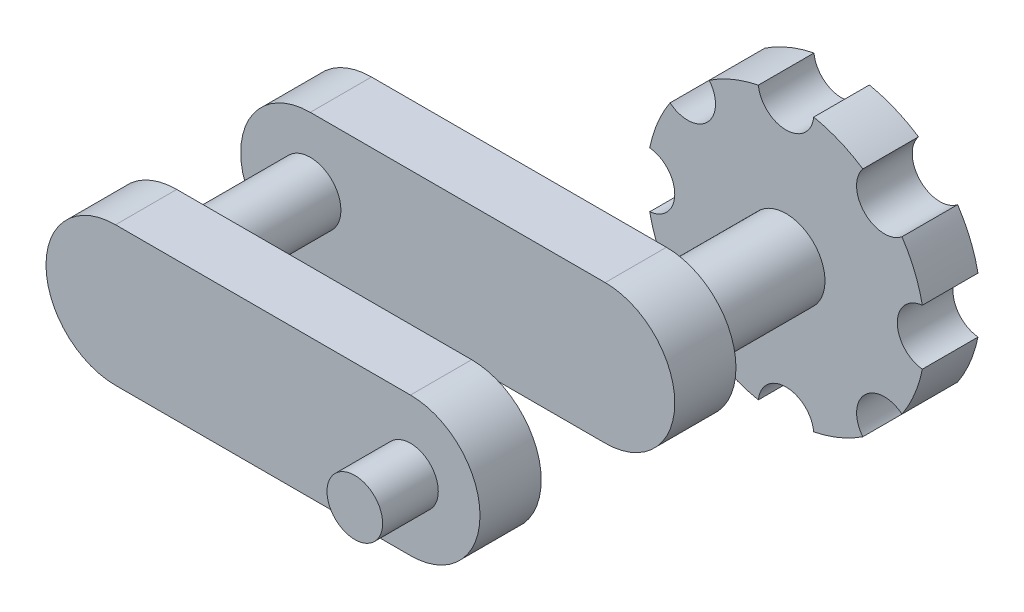
from build123d import *

# Parameters (mm, degrees)
SKETCH1_R           = 5
BOSS_EXTRUDE1_DEPTH = 2
SKETCH2_R           = 1.4
BOSS_EXTRUDE2_DEPTH = 4.3
BOSS_EXTRUDE3_DEPTH = 2.2
SKETCH4_R           = 1.1
BOSS_EXTRUDE4_DEPTH = 4.8
BOSS_EXTRUDE7_DEPTH = 2.2
SKETCH8_R           = 1
BOSS_EXTRUDE8_DEPTH = 2
CUT_EXTRUDE1_REACH  = 24.425
SKETCH9_R           = 1
CIRPATTERN1_COUNT   = 8
SKETCH10_R          = 2
CUT_EXTRUDE3_DEPTH  = 1
FILLET6_R           = 0.5


with BuildPart() as part:
    # Sketch1 → Boss-Extrude1 (new body)
    with BuildSketch(Plane.XY):
        Circle(SKETCH1_R)
    extrude(amount=-BOSS_EXTRUDE1_DEPTH)

    # Sketch2 → Boss-Extrude2 (add)
    with BuildSketch(Plane.XY):
        with Locations(Location((0, 0, 0), (0, 0, 180))):
            Circle(SKETCH2_R)
    extrude(amount=BOSS_EXTRUDE2_DEPTH)

    # Sketch3 → Boss-Extrude3 (add)
    with BuildSketch(Plane.XY.offset(4.3)):
        with BuildLine():
            Line((0, -2.5), (-10.6, -2.5))
            ThreePointArc((-10.6, -2.5), (-13.1, 0), (-10.6, 2.5))
            Line((-10.6, 2.5), (0, 2.5))
            ThreePointArc((0, 2.5), (2.5, 0), (0, -2.5))
        make_face()
    extrude(amount=BOSS_EXTRUDE3_DEPTH)

    # Sketch4 → Boss-Extrude4 (add)
    with BuildSketch(Plane.XY.offset(6.5)):
        with Locations((-10.6, 0)):
            Circle(SKETCH4_R)
    extrude(amount=BOSS_EXTRUDE4_DEPTH)

    # Sketch7 → Boss-Extrude7 (add)
    with BuildSketch(Plane.XY.offset(11.3)):
        with BuildLine():
            Line((-10.6, 2.5), (0, 2.5))
            ThreePointArc((0, 2.5), (2.5, 0), (0, -2.5))
            Line((0, -2.5), (-10.6, -2.5))
            ThreePointArc((-10.6, -2.5), (-13.1, 0), (-10.6, 2.5))
        make_face()
    extrude(amount=BOSS_EXTRUDE7_DEPTH)

    # Sketch8 → Boss-Extrude8 (add)
    with BuildSketch(Plane.XY.offset(13.5)):
        Circle(SKETCH8_R)
    extrude(amount=BOSS_EXTRUDE8_DEPTH)

    # Sketch9 → Cut-Extrude1 (cut, up to next)
    with BuildSketch(Plane(origin=(0, 0, -2), x_dir=(-1, 0, 0), z_dir=(0, 0, -1)), mode=Mode.PRIVATE) as cut_extrude1_sk1:
        with Locations((5, 0)):
            Circle(SKETCH9_R)
    cut_extrude1_tool1 = extrude(cut_extrude1_sk1.sketch, amount=-CUT_EXTRUDE1_REACH, mode=Mode.PRIVATE) & part.part
    cut_extrude1 = cut_extrude1_tool1.solids().sort_by_distance((-5, 0, -2))[0]
    add(cut_extrude1, mode=Mode.SUBTRACT)

    # CirPattern1: Cut-Extrude1 ×8 about axis
    cirpattern1_axis = Axis((0, 0, 0), (0, 0, 1))
    for i in range(1, CIRPATTERN1_COUNT):
        add(cut_extrude1.rotate(cirpattern1_axis, i * 360 / CIRPATTERN1_COUNT), mode=Mode.SUBTRACT)

    # Sketch10 → Cut-Extrude3 (cut)
    with BuildSketch(Plane(origin=(0, 0, -2), x_dir=(-1, 0, 0), z_dir=(0, 0, -1))):
        Circle(SKETCH10_R)
    extrude(amount=-CUT_EXTRUDE3_DEPTH, mode=Mode.SUBTRACT)

    # Fillet6
    fillet6_edges = [part.edges().sort_by_distance(p)[0] for p in [
        (2, 0, -1),
        (2, 0, -2),
    ]]
    fillet(fillet6_edges, radius=FILLET6_R - 0.0001)  # a hair under: the kernel refuses the full size


solid = part.part
